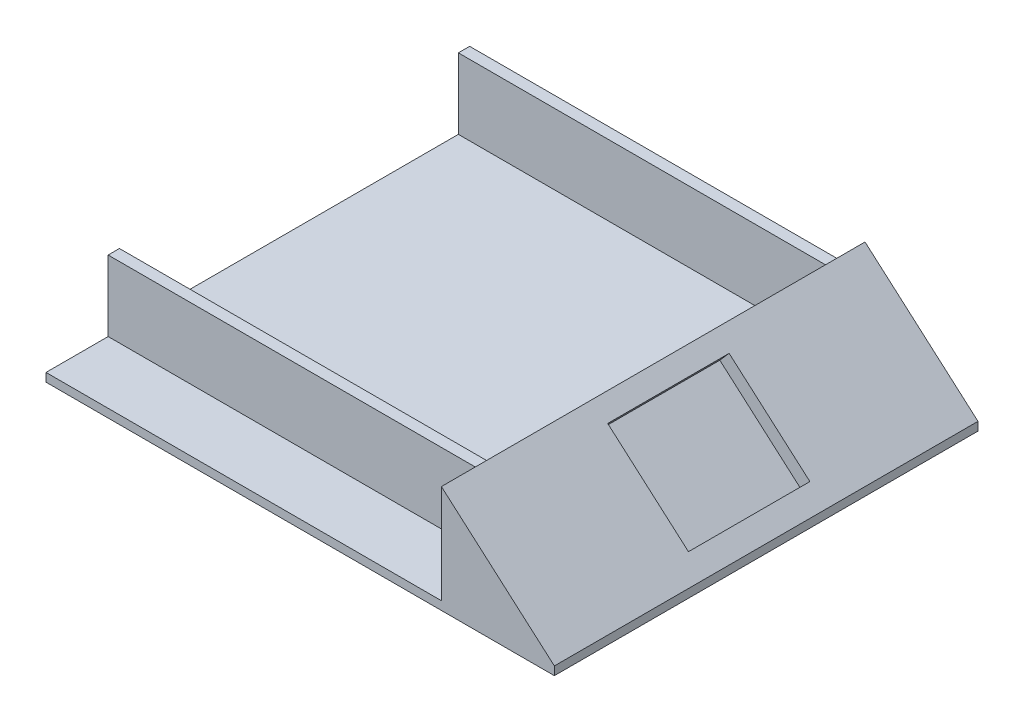
from build123d import *

# Parameters (mm, degrees)
SKETCH1_W           = 180
SKETCH1_H           = 150
BOSS_EXTRUDE1_DEPTH = 3
BOSS_EXTRUDE2_DEPTH = 150
SKETCH3_W           = 140
SKETCH3_H           = 4
BOSS_EXTRUDE3_DEPTH = 25
SKETCH4_W           = 43
SKETCH4_H           = 38
CUT_EXTRUDE1_DEPTH  = 5


with BuildPart() as part:
    # Sketch1 → Boss-Extrude1 (new body)
    with BuildSketch(Plane(origin=(0, 0, 0), x_dir=(1, 0, 0), z_dir=(0, 1, 0))):
        with Locations((90, 75)):
            Rectangle(SKETCH1_W, SKETCH1_H)
    extrude(amount=BOSS_EXTRUDE1_DEPTH)

    # Sketch2 → Boss-Extrude2 (add)
    with BuildSketch(Plane.XY):
        Polygon((180, 3), (140, 38), (140, 3), align=None)
    extrude(amount=-BOSS_EXTRUDE2_DEPTH)

    # Sketch3 → Boss-Extrude3 (add)
    with BuildSketch(Plane(origin=(0, 3, 0), x_dir=(1, 0, 0), z_dir=(0, 1, 0))):
        with Locations((70, 148)):
            Rectangle(SKETCH3_W, SKETCH3_H)
        with Locations((70, 24)):
            Rectangle(SKETCH3_W, SKETCH3_H)
    extrude(amount=BOSS_EXTRUDE3_DEPTH)

    # Sketch4 → Cut-Extrude1 (cut)
    with BuildSketch(Plane(origin=(79.539823009, 90.902654867, 0), x_dir=(0, 0, -1), z_dir=(0.658504607868518, 0.7525766947068779, 0))):
        with Locations((75, -106.488291224)):
            Rectangle(SKETCH4_W, SKETCH4_H)
    extrude(amount=-CUT_EXTRUDE1_DEPTH, mode=Mode.SUBTRACT)


solid = part.part
